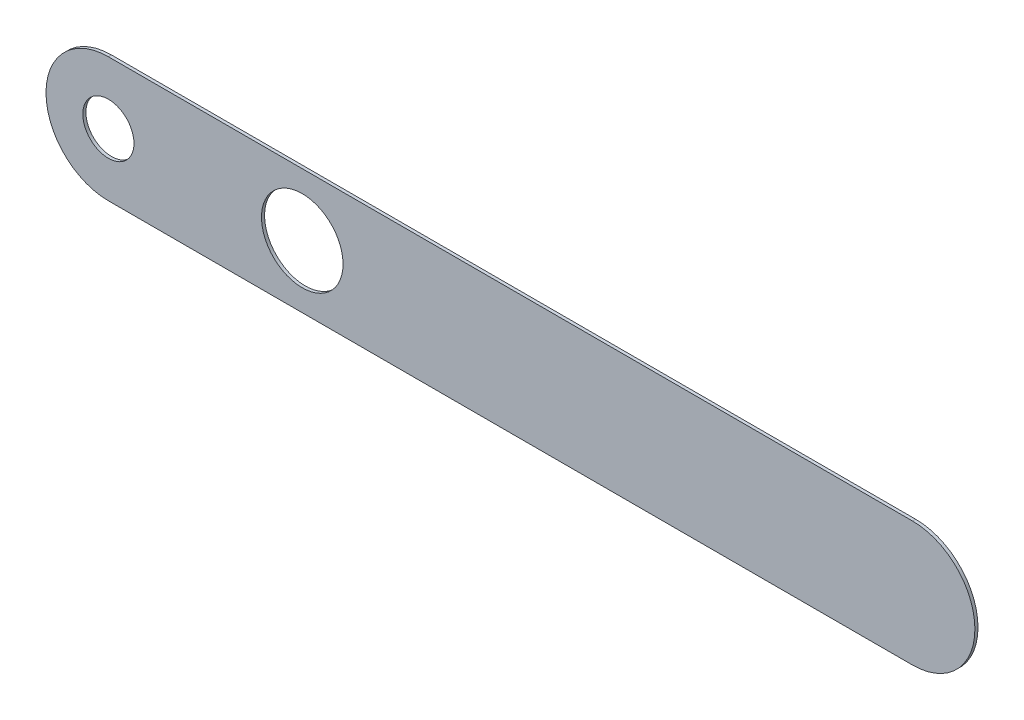
from build123d import *

# Parameters (mm, degrees)
SKETCH1_R          = 9.66552125
SKETCH1_R_2        = 6.063748993
BASE_FLANGE1_DEPTH = 0.7366


# Sheet-metal steps are written as plain solids
with BuildPart() as part:
    # Sketch1 → Base-Flange1 (new body)
    with BuildSketch(Plane.XY):
        with BuildLine():
            Line((-120.91337904, 14.787967221), (69.714702612, 14.787967221))
            ThreePointArc((69.714702612, 14.787967221), (84.502669832, 0), (69.714702612, -14.787967221))
            Line((69.714702612, -14.787967221), (-120.91337904, -14.787967221))
            ThreePointArc((-120.91337904, -14.787967221), (-135.70134626, 0), (-120.91337904, 14.787967221))
        make_face()
        with Locations((-74.953136666, 0)):
            Circle(SKETCH1_R, mode=Mode.SUBTRACT)
        with Locations((-120.91337904, 0)):
            Circle(SKETCH1_R_2, mode=Mode.SUBTRACT)
    extrude(amount=-BASE_FLANGE1_DEPTH)


solid = part.part
